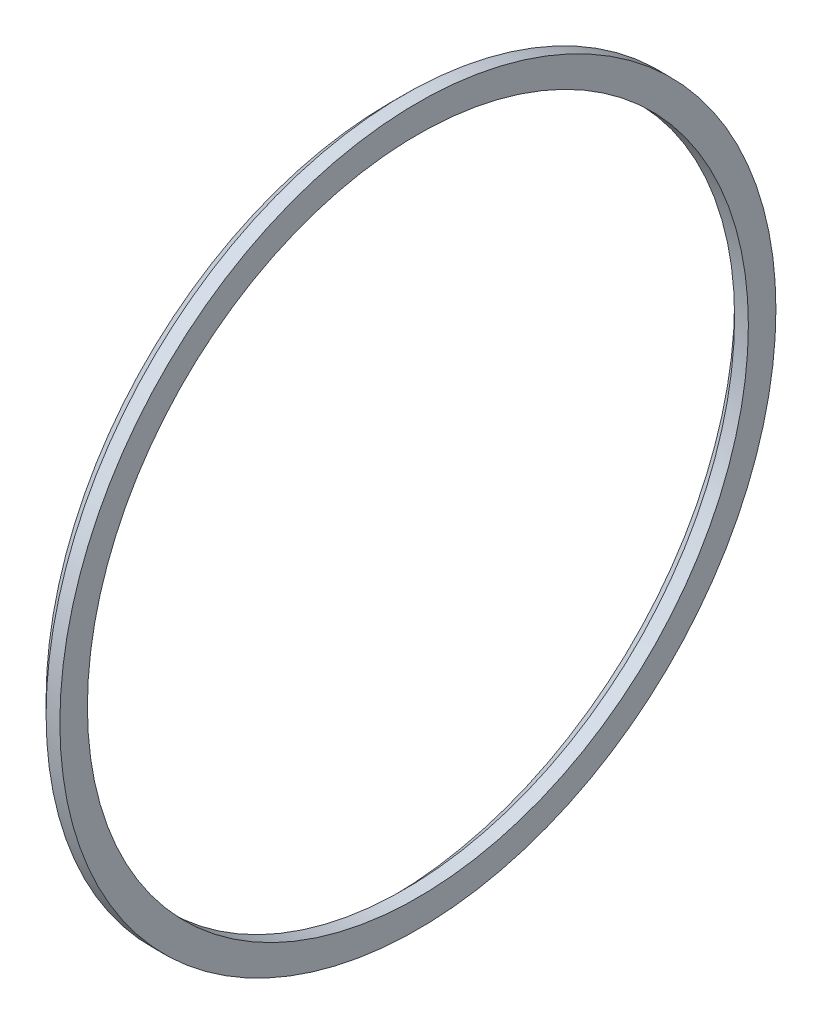
from build123d import *

# Parameters (mm, degrees)
SKETCH1_R           = 13
SKETCH1_R_2         = 12
BOSS_EXTRUDE1_DEPTH = 1
CHAMFER1_SIZE       = 0.5


with BuildPart() as part:
    # Sketch1 → Boss-Extrude1 (new body)
    with BuildSketch(Plane.YZ):
        with Locations(Location((0, 0, 0), (0, 0, 270))):
            Circle(SKETCH1_R)
        with Locations(Location((0, 0, 0), (0, 0, 270))):
            Circle(SKETCH1_R_2, mode=Mode.SUBTRACT)
    extrude(amount=BOSS_EXTRUDE1_DEPTH)

    # Chamfer1
    # the kernel refuses this chamfer: 0.5 mm, written as the material it takes off along each edge
    with BuildSketch(Plane(origin=(0, 0, 0), x_dir=(0, 0, -1), z_dir=(0, -1, 0))) as chamfer1_piece_1:
        Polygon((13, CHAMFER1_SIZE), (13 - CHAMFER1_SIZE, 0), (13, 0), align=None)
    revolve(axis=Axis((0, 0, 0), (1, 0, 0)), mode=Mode.SUBTRACT)
    with BuildSketch(Plane(origin=(0, 0, 0), x_dir=(0, 0, -1), z_dir=(0, -1, 0))) as chamfer1_piece_2:
        Polygon((12, CHAMFER1_SIZE), (12 + CHAMFER1_SIZE, 0), (12, 0), align=None)
    revolve(axis=Axis((0, 0, 0), (1, 0, 0)), mode=Mode.SUBTRACT)


solid = part.part
